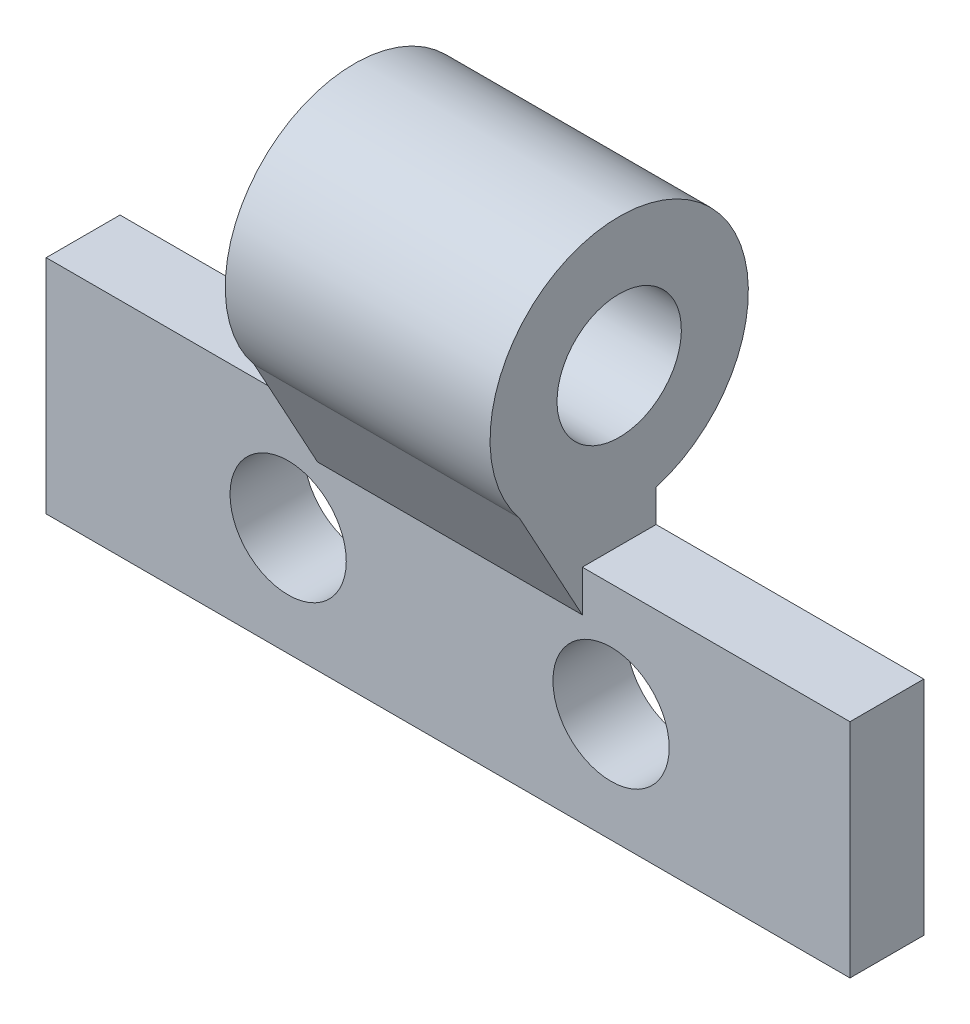
from build123d import *

# Parameters (mm, degrees)
SKETCH1_W           = 24.892
SKETCH1_H           = 7.874
BOSS_EXTRUDE1_DEPTH = 2.286
SKETCH8_R           = 1.8
CUT_EXTRUDE4_DEPTH  = 8.29
BOSS_EXTRUDE2_START = -8.29
SKETCH10_R          = 4
SKETCH10_R_2        = 1.925
BOSS_EXTRUDE2_DEPTH = 8.2
CHAMFER1_START      = -15.87596875
CHAMFER1_DEPTH      = 8.2
SKETCH11_W          = 8.402
SKETCH11_H          = 2.286
SKETCH11_W_2        = 8.29
CUT_EXTRUDE5_DEPTH  = 1


with BuildPart() as part:
    # Sketch1 → Boss-Extrude1 (new body)
    with BuildSketch(Plane.XY):
        with Locations((-11.83196875, 3.65678125)):
            Rectangle(SKETCH1_W, SKETCH1_H)
    extrude(amount=BOSS_EXTRUDE1_DEPTH)

    # Sketch8 → Cut-Extrude4 (cut)
    with BuildSketch(Plane(origin=(0, 0, 0), x_dir=(-1, 0, 0), z_dir=(0, 0, -1))):
        with Locations((6.78496875, 3.09378125)):
            Circle(SKETCH8_R)
        with Locations((16.78496875, 3.09378125)):
            Circle(SKETCH8_R)
    extrude(amount=-CUT_EXTRUDE4_DEPTH, mode=Mode.SUBTRACT)

    # Sketch10 → Boss-Extrude2 (add)
    with BuildSketch(Plane(origin=(0.61403125, 0, 0), x_dir=(0, 0, -1), z_dir=(1, 0, 0)).offset(BOSS_EXTRUDE2_START)):
        with Locations((-1.143, 11.426998045)):
            Circle(SKETCH10_R)
        with Locations(Location((-1.143, 11.426998045, 0), (0, 0, 90))):
            Circle(SKETCH10_R_2, mode=Mode.SUBTRACT)
    extrude(amount=-BOSS_EXTRUDE2_DEPTH)

    # Chamfer1: read off the stored shape, not the designer's step
    # Chamfer1 outline → Chamfer1 (add)
    with BuildSketch(Plane.YZ.offset(CHAMFER1_START)):
        with BuildLine():
            Line((8.88905951, 4.234741902), (5.314022428, 2.286))
            Line((5.314022428, 2.286), (7.59378125, 2.286))
            ThreePointArc((7.59378125, 2.286), (8.095736451, 3.357203285), (8.88905951, 4.234741902))
        make_face()
    extrude(amount=CHAMFER1_DEPTH)

    # Sketch11 → Cut-Extrude5 (cut)
    with BuildSketch(Plane(origin=(0, 7.59378125, 0), x_dir=(1, 0, 0), z_dir=(0, 1, 0))):
        with Locations((-20.07696875, -1.143)):
            Rectangle(SKETCH11_W, SKETCH11_H)
        with Locations((-3.53096875, -1.143)):
            Rectangle(SKETCH11_W_2, SKETCH11_H)
    extrude(amount=-CUT_EXTRUDE5_DEPTH, mode=Mode.SUBTRACT)


solid = part.part
